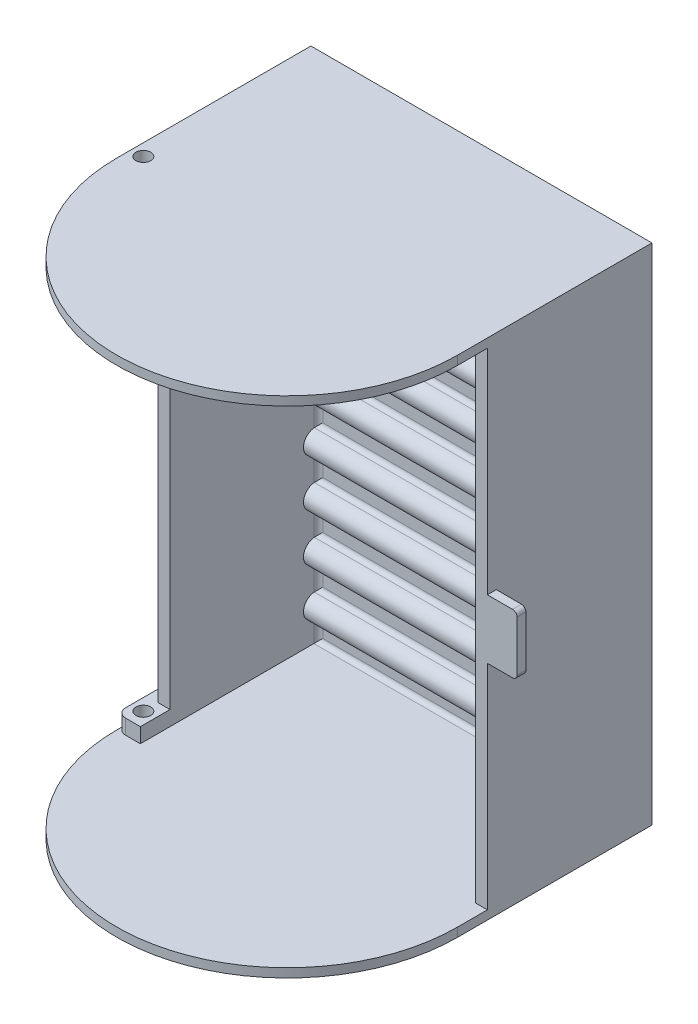
from build123d import *

# Parameters (mm, degrees)
SKETCH_2_W               = 115
SKETCH_2_H               = 170
EXTRUDE_2_DEPTH          = 2.5
EXTRUDE_5_DEPTH          = 3
EXTRUDE_START            = -3
EXTRUDE_6_DEPTH          = 3
EXTRUDE_8_DEPTH          = 8
CUT_EXTRUDE_1_DEPTH      = 188
CUT_EXTRUDE_1_DEPTH_BACK = 20
SKETCH_8_R               = 2.5
FILLET_1_R               = 3
SKETCH_10_W              = 4
SKETCH_10_H              = 164
EXTRUDE_9_DEPTH          = 50
SKETCH_12_W              = 3
SKETCH_12_H              = 20
EXTRUDE_10_DEPTH         = 10
EXTRUDE_11_REACH         = 192.234
FILLET_3_R               = 1.5
SKETCH_15_W              = 115
SKETCH_15_H              = 170
EXTRUDE_12_DEPTH         = 3
SKETCH_16_W              = 4
SKETCH_16_H              = 154
CUT_EXTRUDE_2_DEPTH      = 131.557697973
CUT_EXTRUDE_3_DEPTH      = 3.4


with BuildPart() as part:
    # 草圖2 → 填料-伸長2 (new body)
    with BuildSketch(Plane.XY):
        with Locations((-1.25, 5)):
            Rectangle(SKETCH_2_W, SKETCH_2_H)
    extrude(amount=EXTRUDE_2_DEPTH)

    # 草圖4 → 填料-伸長5 (add)
    with BuildSketch(Plane.XZ.offset(80)):
        with BuildLine():
            Line((-58.75, 2.5), (-58.75, 62.5))
            ThreePointArc((-58.75, 62.5), (-1.25, 120), (56.25, 62.5))
            Line((56.25, 62.5), (56.25, 2.5))
            Line((56.25, 2.5), (-58.75, 2.5))
        make_face()
    extrude(amount=-EXTRUDE_5_DEPTH)

    # 草圖5 → 填料-伸長6 (add)
    with BuildSketch(Plane(origin=(0, 90, 0), x_dir=(1, 0, 0), z_dir=(0, 1, 0)).offset(EXTRUDE_START)):
        with BuildLine():
            Line((-58.75, -2.5), (-58.75, -62.5))
            ThreePointArc((-58.75, -62.5), (-1.25, -120), (56.25, -62.5))
            Line((56.25, -62.5), (56.25, -2.5))
            Line((56.25, -2.5), (-58.75, -2.5))
        make_face()
    extrude(amount=EXTRUDE_6_DEPTH)

    # 草圖7 → 填料-伸長8 (add)
    with BuildSketch(Plane.ZY.offset(58.75)):
        Polygon((2.5, 87), (62.5, 87), (62.5, 82), (52.5, 82), (52.5, -72), (62.5, -72), (62.5, -77), (2.5, -77), align=None)
    extrude(amount=-EXTRUDE_8_DEPTH)

    # 草圖8 → 除料-伸長1 (cut, two sides: drawn at the far end of the back side and taken through both)
    with BuildSketch(Plane.XZ.offset(-82).offset(-CUT_EXTRUDE_1_DEPTH_BACK)):
        with Locations(Location((-54.75, 57.5, 0), (0, 0, 90))):
            Circle(SKETCH_8_R)
    extrude(amount=CUT_EXTRUDE_1_DEPTH + CUT_EXTRUDE_1_DEPTH_BACK, mode=Mode.SUBTRACT)

    # 圓角1
    fillet_1_edges = [part.edges().sort_by_distance(p)[0] for p in [
        (-58.75, -74.5, 62.5),
        (-58.75, 84.5, 62.5),
    ]]
    fillet(fillet_1_edges, radius=FILLET_1_R)

    # 草圖10 → 填料-伸長9 (add)
    with BuildSketch(Plane.XY.offset(2.5)):
        with Locations((54.25, 5)):
            Rectangle(SKETCH_10_W, SKETCH_10_H)
    extrude(amount=EXTRUDE_9_DEPTH)

    # 草圖12 → 填料-伸長10 (add)
    with BuildSketch(Plane(origin=(56.25, 0, 0), x_dir=(0, 0, -1), z_dir=(1, 0, 0))):
        with Locations((-51, 5)):
            Rectangle(SKETCH_12_W, SKETCH_12_H)
    extrude(amount=EXTRUDE_10_DEPTH)

    # 草圖14 → 填料-伸長11 (add, up to next)
    with BuildSketch(Plane(origin=(-50.75, 0, 0), x_dir=(0, 0, -1), z_dir=(1, 0, 0)), mode=Mode.PRIVATE) as extrude_11_sk1:
        with BuildLine():
            Line((-2.5, -54), (-3.5, -54))
            ThreePointArc((-3.5, -54), (-7.5, -50), (-3.5, -46))
            Line((-3.5, -46), (-2.5, -46))
            Line((-2.5, -46), (-2.5, -54))
        make_face()
    extrude_11_tool1 = extrude(extrude_11_sk1.sketch, amount=EXTRUDE_11_REACH, mode=Mode.PRIVATE) - part.part
    # 草圖14 → 填料-伸長11 (add, up to next)
    with BuildSketch(Plane(origin=(-50.75, 0, 0), x_dir=(0, 0, -1), z_dir=(1, 0, 0)), mode=Mode.PRIVATE) as extrude_11_sk2:
        with BuildLine():
            Line((-2.5, -70), (-3.5, -70))
            ThreePointArc((-3.5, -70), (-7.5, -66), (-3.5, -62))
            Line((-3.5, -62), (-2.5, -62))
            Line((-2.5, -62), (-2.5, -70))
        make_face()
    extrude_11_tool2 = extrude(extrude_11_sk2.sketch, amount=EXTRUDE_11_REACH, mode=Mode.PRIVATE) - part.part
    # 草圖14 → 填料-伸長11 (add, up to next)
    with BuildSketch(Plane(origin=(-50.75, 0, 0), x_dir=(0, 0, -1), z_dir=(1, 0, 0)), mode=Mode.PRIVATE) as extrude_11_sk3:
        with BuildLine():
            Line((-2.5, -38), (-3.5, -38))
            ThreePointArc((-3.5, -38), (-7.5, -34), (-3.5, -30))
            Line((-3.5, -30), (-2.5, -30))
            Line((-2.5, -30), (-2.5, -38))
        make_face()
    extrude_11_tool3 = extrude(extrude_11_sk3.sketch, amount=EXTRUDE_11_REACH, mode=Mode.PRIVATE) - part.part
    # 草圖14 → 填料-伸長11 (add, up to next)
    with BuildSketch(Plane(origin=(-50.75, 0, 0), x_dir=(0, 0, -1), z_dir=(1, 0, 0)), mode=Mode.PRIVATE) as extrude_11_sk4:
        with BuildLine():
            Line((-2.5, -22), (-3.5, -22))
            ThreePointArc((-3.5, -22), (-7.5, -18), (-3.5, -14))
            Line((-3.5, -14), (-2.5, -14))
            Line((-2.5, -14), (-2.5, -22))
        make_face()
    extrude_11_tool4 = extrude(extrude_11_sk4.sketch, amount=EXTRUDE_11_REACH, mode=Mode.PRIVATE) - part.part
    # 草圖14 → 填料-伸長11 (add, up to next)
    with BuildSketch(Plane(origin=(-50.75, 0, 0), x_dir=(0, 0, -1), z_dir=(1, 0, 0)), mode=Mode.PRIVATE) as extrude_11_sk5:
        with BuildLine():
            Line((-2.5, -6), (-3.5, -6))
            ThreePointArc((-3.5, -6), (-7.5, -2), (-3.5, 2))
            Line((-3.5, 2), (-2.5, 2))
            Line((-2.5, 2), (-2.5, -6))
        make_face()
    extrude_11_tool5 = extrude(extrude_11_sk5.sketch, amount=EXTRUDE_11_REACH, mode=Mode.PRIVATE) - part.part
    # 草圖14 → 填料-伸長11 (add, up to next)
    with BuildSketch(Plane(origin=(-50.75, 0, 0), x_dir=(0, 0, -1), z_dir=(1, 0, 0)), mode=Mode.PRIVATE) as extrude_11_sk6:
        with BuildLine():
            Line((-2.5, 10), (-3.5, 10))
            ThreePointArc((-3.5, 10), (-7.5, 14), (-3.5, 18))
            Line((-3.5, 18), (-2.5, 18))
            Line((-2.5, 18), (-2.5, 10))
        make_face()
    extrude_11_tool6 = extrude(extrude_11_sk6.sketch, amount=EXTRUDE_11_REACH, mode=Mode.PRIVATE) - part.part
    # 草圖14 → 填料-伸長11 (add, up to next)
    with BuildSketch(Plane(origin=(-50.75, 0, 0), x_dir=(0, 0, -1), z_dir=(1, 0, 0)), mode=Mode.PRIVATE) as extrude_11_sk7:
        with BuildLine():
            Line((-2.5, 26), (-3.5, 26))
            ThreePointArc((-3.5, 26), (-7.5, 30), (-3.5, 34))
            Line((-3.5, 34), (-2.5, 34))
            Line((-2.5, 34), (-2.5, 26))
        make_face()
    extrude_11_tool7 = extrude(extrude_11_sk7.sketch, amount=EXTRUDE_11_REACH, mode=Mode.PRIVATE) - part.part
    # 草圖14 → 填料-伸長11 (add, up to next)
    with BuildSketch(Plane(origin=(-50.75, 0, 0), x_dir=(0, 0, -1), z_dir=(1, 0, 0)), mode=Mode.PRIVATE) as extrude_11_sk8:
        with BuildLine():
            Line((-2.5, 42), (-3.5, 42))
            ThreePointArc((-3.5, 42), (-7.5, 46), (-3.5, 50))
            Line((-3.5, 50), (-2.5, 50))
            Line((-2.5, 50), (-2.5, 42))
        make_face()
    extrude_11_tool8 = extrude(extrude_11_sk8.sketch, amount=EXTRUDE_11_REACH, mode=Mode.PRIVATE) - part.part
    # 草圖14 → 填料-伸長11 (add, up to next)
    with BuildSketch(Plane(origin=(-50.75, 0, 0), x_dir=(0, 0, -1), z_dir=(1, 0, 0)), mode=Mode.PRIVATE) as extrude_11_sk9:
        with BuildLine():
            Line((-2.5, 58), (-3.5, 58))
            ThreePointArc((-3.5, 58), (-7.5, 62), (-3.5, 66))
            Line((-3.5, 66), (-2.5, 66))
            Line((-2.5, 66), (-2.5, 58))
        make_face()
    extrude_11_tool9 = extrude(extrude_11_sk9.sketch, amount=EXTRUDE_11_REACH, mode=Mode.PRIVATE) - part.part
    # 草圖14 → 填料-伸長11 (add, up to next)
    with BuildSketch(Plane(origin=(-50.75, 0, 0), x_dir=(0, 0, -1), z_dir=(1, 0, 0)), mode=Mode.PRIVATE) as extrude_11_sk10:
        with BuildLine():
            Line((-2.5, 74), (-3.5, 74))
            ThreePointArc((-3.5, 74), (-7.5, 78), (-3.5, 82))
            Line((-3.5, 82), (-2.5, 82))
            Line((-2.5, 82), (-2.5, 74))
        make_face()
    extrude_11_tool10 = extrude(extrude_11_sk10.sketch, amount=EXTRUDE_11_REACH, mode=Mode.PRIVATE) - part.part
    add(extrude_11_tool1.solids().sort_by_distance((-50.75, -50, 4.667023))[0])
    add(extrude_11_tool2.solids().sort_by_distance((-50.75, -66, 4.667023))[0])
    add(extrude_11_tool3.solids().sort_by_distance((-50.75, -34, 4.667023))[0])
    add(extrude_11_tool4.solids().sort_by_distance((-50.75, -18, 4.667023))[0])
    add(extrude_11_tool5.solids().sort_by_distance((-50.75, -2, 4.667023))[0])
    add(extrude_11_tool6.solids().sort_by_distance((-50.75, 14, 4.667023))[0])
    add(extrude_11_tool7.solids().sort_by_distance((-50.75, 30, 4.667023))[0])
    add(extrude_11_tool8.solids().sort_by_distance((-50.75, 46, 4.667023))[0])
    add(extrude_11_tool9.solids().sort_by_distance((-50.75, 62, 4.667023))[0])
    add(extrude_11_tool10.solids().sort_by_distance((-50.75, 78, 4.667023))[0])

    # 圓角3
    # the kernel refuses this fillet: 1.5 mm, written as the material it adds along each edge
    with BuildSketch(Plane(origin=(56, -77, 2.5), x_dir=(0, 0, 1), z_dir=(-1, 0, 0))) as fillet_3_piece_1:
        with BuildLine():
            CenterArc((FILLET_3_R, FILLET_3_R), FILLET_3_R, 180, 90)
            Line((0, FILLET_3_R), (0, 0))
            Line((0, 0), (FILLET_3_R, 0))
        make_face()
    fillet_3_piece_1_solid = extrude(amount=110.5, mode=Mode.PRIVATE)
    with BuildSketch(Plane(origin=(52.25, -80.75, 2.5), x_dir=(-1, 0, 0), z_dir=(0, 1, 0))) as fillet_3_piece_2_section:
        with BuildLine():
            CenterArc((FILLET_3_R, FILLET_3_R), FILLET_3_R, 180, 90)
            Line((0, FILLET_3_R), (0, 0))
            Line((0, 0), (FILLET_3_R, 0))
        make_face()
    fillet_3_piece_2 = extrude(amount=14.5, mode=Mode.PRIVATE)
    fillet_3_piece_2 = split(fillet_3_piece_2, bisect_by=Plane(origin=(52.25, -80, 2.5), z_dir=(0, 1, 0)), keep=Keep.TOP, mode=Mode.PRIVATE)
    with BuildSketch(Plane(origin=(-50.75, -80.75, 2.5), x_dir=(0, 0, 1), z_dir=(0, 1, 0))) as fillet_3_piece_3_section:
        with BuildLine():
            CenterArc((FILLET_3_R, FILLET_3_R), FILLET_3_R, 180, 90)
            Line((0, FILLET_3_R), (0, 0))
            Line((0, 0), (FILLET_3_R, 0))
        make_face()
    fillet_3_piece_3 = extrude(amount=14.5, mode=Mode.PRIVATE)
    fillet_3_piece_3 = split(fillet_3_piece_3, bisect_by=Plane(origin=(-50.75, -80, 2.5), z_dir=(0, 1, 0)), keep=Keep.TOP, mode=Mode.PRIVATE)
    with BuildSketch(Plane(origin=(-54.443063938, -62, 2.5), x_dir=(0, 1, 0), z_dir=(1, 0, 0)), Plane(origin=(-54.443063938, 66, 2.5), x_dir=(0, 1, 0), z_dir=(1, 0, 0)), Plane(origin=(-54.443063938, 50, 2.5), x_dir=(0, 1, 0), z_dir=(1, 0, 0)), Plane(origin=(-54.443063938, 34, 2.5), x_dir=(0, 1, 0), z_dir=(1, 0, 0)), Plane(origin=(-54.443063938, 18, 2.5), x_dir=(0, 1, 0), z_dir=(1, 0, 0)), Plane(origin=(-54.443063938, 2, 2.5), x_dir=(0, 1, 0), z_dir=(1, 0, 0)), Plane(origin=(-54.443063938, -14, 2.5), x_dir=(0, 1, 0), z_dir=(1, 0, 0)), Plane(origin=(-54.443063938, -30, 2.5), x_dir=(0, 1, 0), z_dir=(1, 0, 0)), Plane(origin=(-54.443063938, -46, 2.5), x_dir=(0, 1, 0), z_dir=(1, 0, 0))) as fillet_3_piece_4:
        with BuildLine():
            CenterArc((1.477225575, 1.5), FILLET_3_R, 185.21590857, 84.78409143)
            Line((-0.016563218, 1.363636364), (-0.165942097, 1.35))
            ThreePointArc((-0.165942097, 1.35), (-0.15, 1), (-0.15, 0))
            Line((-0.15, 0), (0, -0.15))
            Line((0, -0.15), (1.477225575, -0.15))
            Line((1.477225575, -0.15), (1.477225575, 0))
        make_face()
    fillet_3_piece_4_solid = extrude(amount=110.386127875, mode=Mode.PRIVATE)
    with BuildSketch(Plane(origin=(-54.443063938, -70, 2.5), x_dir=(0, -1, 0), z_dir=(1, 0, 0))) as fillet_3_piece_5:
        with BuildLine():
            CenterArc((1.477225575, -1.5), FILLET_3_R, 90, 84.78409143)
            Line((-0.016563218, -1.363636364), (-0.165942097, -1.35))
            ThreePointArc((-0.165942097, -1.35), (-0.15, -1), (-0.15, 0))
            Line((-0.15, 0), (0, 0.15))
            Line((0, 0.15), (1.477225575, 0.15))
            Line((1.477225575, 0.15), (1.477225575, 0))
        make_face()
    fillet_3_piece_5_solid = extrude(amount=110.386127875, mode=Mode.PRIVATE)
    with BuildSketch(Plane(origin=(-50.75, 62.25, 2.5), x_dir=(0, 0, 1), z_dir=(0, 1, 0)), Plane(origin=(-50.75, 46.25, 2.5), x_dir=(0, 0, 1), z_dir=(0, 1, 0)), Plane(origin=(-50.75, 30.25, 2.5), x_dir=(0, 0, 1), z_dir=(0, 1, 0)), Plane(origin=(-50.75, 14.25, 2.5), x_dir=(0, 0, 1), z_dir=(0, 1, 0)), Plane(origin=(-50.75, -1.75, 2.5), x_dir=(0, 0, 1), z_dir=(0, 1, 0)), Plane(origin=(-50.75, -17.75, 2.5), x_dir=(0, 0, 1), z_dir=(0, 1, 0)), Plane(origin=(-50.75, -33.75, 2.5), x_dir=(0, 0, 1), z_dir=(0, 1, 0)), Plane(origin=(-50.75, -49.75, 2.5), x_dir=(0, 0, 1), z_dir=(0, 1, 0)), Plane(origin=(-50.75, -65.75, 2.5), x_dir=(0, 0, 1), z_dir=(0, 1, 0))) as fillet_3_piece_6:
        with BuildLine():
            CenterArc((FILLET_3_R, FILLET_3_R), FILLET_3_R, 180, 90)
            Line((0, FILLET_3_R), (0, 0))
            Line((0, 0), (FILLET_3_R, 0))
        make_face()
    fillet_3_piece_6_solid = extrude(amount=15.5, mode=Mode.PRIVATE)
    with BuildSketch(Plane(origin=(-54.443063938, 74, 2.5), x_dir=(0, 0.012145464070653266, 0.9999262411310689), z_dir=(1, 0, 0)), Plane(origin=(-54.443063938, 58, 2.5), x_dir=(0, 0.012145464070652905, 0.9999262411310689), z_dir=(1, 0, 0)), Plane(origin=(-54.443063938, 42, 2.5), x_dir=(0, 0.012145464070662944, 0.9999262411310688), z_dir=(1, 0, 0)), Plane(origin=(-54.443063938, 26, 2.5), x_dir=(0, 0.01214546407065738, 0.9999262411310688), z_dir=(1, 0, 0)), Plane(origin=(-54.443063938, 10, 2.5), x_dir=(0, 0.012145464070662226, 0.9999262411310688), z_dir=(1, 0, 0)), Plane(origin=(-54.443063938, -6, 2.5), x_dir=(0, 0.012145464070663818, 0.9999262411310688), z_dir=(1, 0, 0)), Plane(origin=(-54.443063938, -22, 2.5), x_dir=(0, 0.01214546407066931, 0.9999262411310685), z_dir=(1, 0, 0)), Plane(origin=(-54.443063938, -38, 2.5), x_dir=(0, 0.012145464070671555, 0.9999262411310685), z_dir=(1, 0, 0)), Plane(origin=(-54.443063938, -54, 2.5), x_dir=(0, 0.012145464070676402, 0.9999262411310685), z_dir=(1, 0, 0))) as fillet_3_piece_7:
        with BuildLine():
            CenterArc((1.481947772, 1.495334813), FILLET_3_R, 180.695900941, 84.78409143)
            Line((-0.01794159, 1.477116617), (-0.167930526, 1.475294797))
            Line((-0.167930526, 1.475294797), (-0.149988936, -0.00182182))
            Line((-0.149988936, -0.00182182), (0.00182182, -0.149988936))
            ThreePointArc((0.00182182, -0.149988936), (1.001748061, -0.137843472), (1.351915869, -0.149533481))
            Line((1.351915869, -0.149533481), (1.363736951, 0))
        make_face()
    fillet_3_piece_7_solid = extrude(amount=110.386127875, mode=Mode.PRIVATE)
    with BuildSketch(Plane(origin=(52.25, 62.25, 2.5), x_dir=(0, 0, 1), z_dir=(0, 1, 0)), Plane(origin=(52.25, 46.25, 2.5), x_dir=(0, 0, 1), z_dir=(0, 1, 0)), Plane(origin=(52.25, 30.25, 2.5), x_dir=(0, 0, 1), z_dir=(0, 1, 0)), Plane(origin=(52.25, 14.25, 2.5), x_dir=(0, 0, 1), z_dir=(0, 1, 0)), Plane(origin=(52.25, -1.75, 2.5), x_dir=(0, 0, 1), z_dir=(0, 1, 0)), Plane(origin=(52.25, -17.75, 2.5), x_dir=(0, 0, 1), z_dir=(0, 1, 0)), Plane(origin=(52.25, -33.75, 2.5), x_dir=(0, 0, 1), z_dir=(0, 1, 0)), Plane(origin=(52.25, -49.75, 2.5), x_dir=(0, 0, 1), z_dir=(0, 1, 0)), Plane(origin=(52.25, -65.75, 2.5), x_dir=(0, 0, 1), z_dir=(0, 1, 0))) as fillet_3_piece_8:
        with BuildLine():
            CenterArc((FILLET_3_R, -FILLET_3_R), FILLET_3_R, 90, 90)
            Line((0, -FILLET_3_R), (0, 0))
            Line((0, 0), (FILLET_3_R, 0))
        make_face()
    fillet_3_piece_8_solid = extrude(amount=15.5, mode=Mode.PRIVATE)
    add([fillet_3_piece_1_solid, fillet_3_piece_2, fillet_3_piece_3, fillet_3_piece_4_solid, fillet_3_piece_5_solid, fillet_3_piece_6_solid, fillet_3_piece_7_solid, fillet_3_piece_8_solid])
    # the kernel refuses this fillet: 1.5 mm, written as the material it takes off along each edge
    with BuildSketch(Plane(origin=(66.25, 15, 56.25), x_dir=(-1, 0, 0), z_dir=(0, 0, -1))) as fillet_3_2_piece_1:
        with BuildLine():
            CenterArc((FILLET_3_R, -FILLET_3_R), FILLET_3_R, 90, 90)
            Line((0, -FILLET_3_R), (0, 0))
            Line((0, 0), (FILLET_3_R, 0))
        make_face()
    fillet_3_2_piece_1_solid = extrude(amount=10.5, mode=Mode.PRIVATE)
    with BuildSketch(Plane(origin=(66.25, -5, 45.75), x_dir=(0, 1, 0), z_dir=(0, 0, 1))) as fillet_3_2_piece_2:
        with BuildLine():
            CenterArc((FILLET_3_R, FILLET_3_R), FILLET_3_R, 180, 90)
            Line((0, FILLET_3_R), (0, 0))
            Line((0, 0), (FILLET_3_R, 0))
        make_face()
    fillet_3_2_piece_2_solid = extrude(amount=10.5, mode=Mode.PRIVATE)
    add([fillet_3_2_piece_1_solid, fillet_3_2_piece_2_solid], mode=Mode.SUBTRACT)

    # 草圖15 → 填料-伸長12 (add)
    with BuildSketch(Plane(origin=(0, 0, 0), x_dir=(-1, 0, 0), z_dir=(0, 0, -1))):
        with Locations((1.25, 5)):
            Rectangle(SKETCH_15_W, SKETCH_15_H)
    extrude(amount=EXTRUDE_12_DEPTH)

    # 草圖16 → 除料-伸長2 (cut, through all)
    with BuildSketch(Plane.XY.offset(52.5)):
        with Locations((-56.75, 5)):
            Rectangle(SKETCH_16_W, SKETCH_16_H)
    extrude(amount=-CUT_EXTRUDE_2_DEPTH, mode=Mode.SUBTRACT)

    # 草圖17 → 除料-伸長3 (cut)
    with BuildSketch(Plane(origin=(0, 0, -3), x_dir=(-1, 0, 0), z_dir=(0, 0, -1))):
        with BuildLine():
            Line((8.75, 12.5), (8.75, -2.5))
            ThreePointArc((8.75, -2.5), (1.25, -10), (-6.25, -2.5))
            Line((-6.25, -2.5), (-6.25, 12.5))
            ThreePointArc((-6.25, 12.5), (1.25, 20), (8.75, 12.5))
        make_face()
    extrude(amount=-CUT_EXTRUDE_3_DEPTH, mode=Mode.SUBTRACT)


solid = part.part
